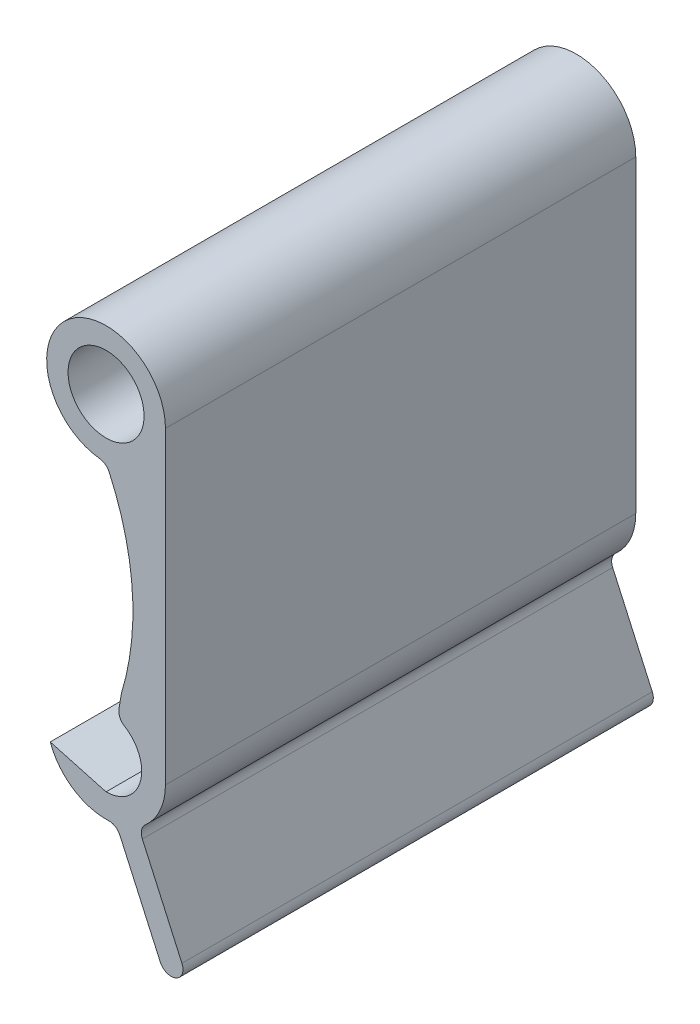
from build123d import *

# Parameters (mm, degrees)
SKETCH1_R           = 2.5
SKETCH1_R_2         = 1.6
BOSS_EXTRUDE1_DEPTH = 19.8
FILLET1_R           = 0.5
BOSS_EXTRUDE2_START = -19.8
BOSS_EXTRUDE2_DEPTH = 19.8
FILLET2_R           = 0.5


with BuildPart() as part:
    # Sketch1 → Boss-Extrude1 (new body)
    # profile 1 of 5: a face of its own
    with BuildSketch(Plane.XY):
        Circle(SKETCH1_R)
        with Locations(Location((0, 0, 0), (0, 0, 180))):
            Circle(SKETCH1_R_2, mode=Mode.SUBTRACT)
    # profile 2 of 5: a face of its own
    with BuildSketch(Plane.XY):
        with BuildLine():
            Line((2.5, -13), (2.5, 0))
            ThreePointArc((2.5, 0), (1.767766953, -1.767766953), (0, -2.5))
            ThreePointArc((0, -2.5), (1.095258289, -6.480732801), (0.645816542, -10.584855906))
            ThreePointArc((0.645816542, -10.584855906), (1.98299538, -11.477590948), (2.5, -13))
        make_face()
    # profile 3 of 5: a face of its own
    with BuildSketch(Plane.XY):
        with BuildLine():
            ThreePointArc((-2.228856339, -14.132342448), (0.582176585, -15.431269303), (2.5, -13))
            ThreePointArc((2.5, -13), (1.98299538, -11.477590948), (0.645816542, -10.584855906))
            Line((0.645816542, -10.584855906), (0.481752062, -11.579466667))
            ThreePointArc((0.481752062, -11.579466667), (1.48, -13.244131112), (0, -14.5))
            ThreePointArc((0, -14.5), (-0.244131112, -14.48), (-0.481752062, -14.420533333))
            Line((-0.481752062, -14.420533333), (-2.228856339, -14.132342448))
        make_face()
    # profile 4 of 5: a face of its own
    with BuildSketch(Plane.XY):
        with BuildLine():
            Line((0, -14.5), (-0.481752062, -14.420533333))
            ThreePointArc((-0.481752062, -14.420533333), (-0.244131112, -14.48), (0, -14.5))
        make_face()
    # profile 5 of 5: a face of its own
    with BuildSketch(Plane.XY):
        with BuildLine():
            ThreePointArc((-2.34950307, -13.854304), (-2.293397058, -13.995153222), (-2.228856339, -14.132342448))
            Line((-2.228856339, -14.132342448), (-0.481752062, -14.420533333))
            Line((-0.481752062, -14.420533333), (0, -14.5))
            Line((0, -14.5), (-2.34950307, -13.854304))
        make_face()
    extrude(amount=BOSS_EXTRUDE1_DEPTH)

    # Fillet1
    fillet1_edges = [part.edges().sort_by_distance(p)[0] for p in [
        (0.481752062, -11.579466667, 9.9),
        (0, -2.5, 9.9),
    ]]
    fillet(fillet1_edges, radius=FILLET1_R)

    # Sketch2 → Boss-Extrude2 (add)
    with BuildSketch(Plane.XY.offset(19.8).offset(BOSS_EXTRUDE2_START)):
        with BuildLine():
            Line((3.400304681, -19.609307967), (1.36493731, -15.094503793))
            ThreePointArc((1.36493731, -15.094503793), (0.917921591, -15.325385979), (0.433729366, -15.462088308))
            Line((0.433729366, -15.462088308), (2.488663388, -20.020294772))
            Line((2.488663388, -20.020294772), (3.400304681, -19.609307967))
        make_face()
    extrude(amount=BOSS_EXTRUDE2_DEPTH)

    # Fillet2
    fillet2_edges = [part.edges().sort_by_distance(p)[0] for p in [
        (0.433729366, -15.462088308, 9.9),
        (1.36493731, -15.094503793, 9.9),
        (3.400304681, -19.609307967, 9.9),
        (2.488663388, -20.020294772, 9.9),
    ]]
    fillet(fillet2_edges, radius=FILLET2_R - 0.0001)  # a hair under: the kernel refuses the full size


solid = part.part
